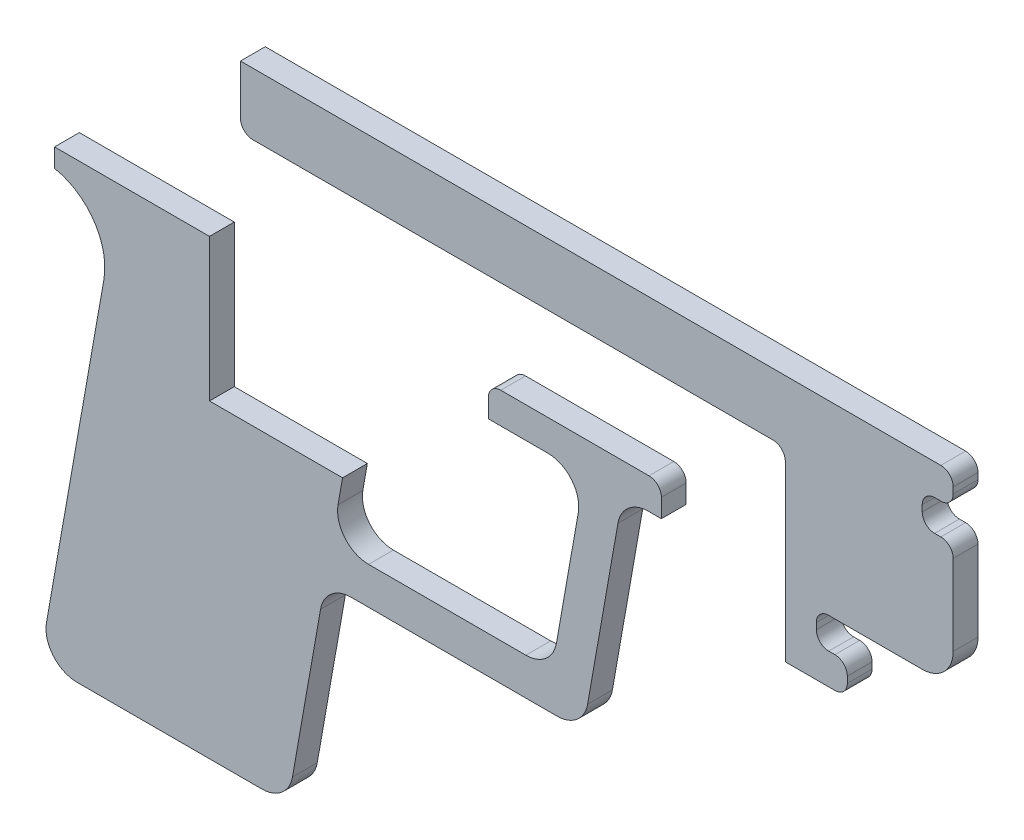
from build123d import *

# Parameters (mm, degrees)
BOSS_EXTRUDE1_DEPTH = 4
FILLET1_R           = 10
FILLET2_R           = 5
CUT_EXTRUDE1_DEPTH  = 4
LPATTERN1_COUNT     = 6
LPATTERN1_PITCH     = 4
FILLET3_R           = 2
FILLET4_R           = 2
BOSS_EXTRUDE2_DEPTH = 4
FILLET5_R           = 2
CUT_EXTRUDE2_DEPTH  = 4
FILLET6_R           = 2
FILLET7_R           = 2
FILLET8_R           = 2
FILLET9_R           = 2


with BuildPart() as part:
    # Sketch1 → Boss-Extrude1 (new body)
    with BuildSketch(Plane.XY):
        Polygon((10, 0), (-2.34288865, -70), (37.65711135, -70), (43.652228694, -36), (85.284719782, -36), (91.632491087, 0), (145, 0), (145, 20), (140, 20), (140, 25), (145, 25), (145, 30), (0, 30), (0, 0), align=None)
        Polygon((44.710190579, -30), (80.250121995, -30), (85.539931416, 0), (50, 0), align=None, mode=Mode.SUBTRACT)
    extrude(amount=BOSS_EXTRUDE1_DEPTH)

    # Fillet1
    # the kernel refuses this fillet: 10 mm, written as the material it adds along each edge
    with BuildSketch(Plane(origin=(10, 0, 0), x_dir=(-0.17364817766693433, -0.9848077530122074, 0), z_dir=(0, 0, 1))) as fillet1_piece_1:
        with BuildLine():
            CenterArc((11.735327688, -10), FILLET1_R, 90, 89.129514879)
            Line((1.736481777, -9.84807753), (1.536504858, -9.845039081))
            ThreePointArc((1.536504858, -9.845039081), (0.671279338, -4.958768401), (-0.196961551, -0.034729636))
            Line((-0.196961551, -0.034729636), (0, 0.2))
            Line((0, 0.2), (11.735327688, 0.2))
            Line((11.735327688, 0.2), (11.735327688, 0))
        make_face()
    extrude(amount=4)

    # Fillet2
    fillet2_edges = [part.edges().sort_by_distance(p)[0] for p in [
        (145, 0, 2),
        (91.632491087, 0, 2),
        (85.284719782, -36, 2),
        (43.652228694, -36, 2),
        (37.65711135, -70, 2),
        (-2.34288865, -70, 2),
        (85.539931416, 0, 2),
        (50, 0, 2),
        (44.710190579, -30, 2),
        (80.250121995, -30, 2),
    ]]
    fillet(fillet2_edges, radius=FILLET2_R)

    # Sketch2 → Cut-Extrude1 (cut)
    with BuildSketch(Plane.XY.offset(4)):
        Polygon((0, 27), (4, 27), (0, 23), align=None)
    cut_extrude1 = extrude(amount=-CUT_EXTRUDE1_DEPTH, mode=Mode.SUBTRACT)

    # LPattern1: Cut-Extrude1 ×6
    with Locations(*[(0, -i * LPATTERN1_PITCH, 0) for i in range(1, LPATTERN1_COUNT)]):
        add(cut_extrude1, mode=Mode.SUBTRACT)

    # Fillet3
    fillet3_edges = [part.edges().sort_by_distance(p)[0] for p in [
        (145, 25, 2),
        (140, 25, 2),
        (140, 20, 2),
        (145, 20, 2),
    ]]
    fillet(fillet3_edges, radius=FILLET3_R)

    # Fillet4
    fillet4_edges = [part.edges().sort_by_distance(p)[0] for p in [
        (145, 30, 2),
    ]]
    fillet(fillet4_edges, radius=FILLET4_R)

    # Sketch3 → Boss-Extrude2 (add)
    with BuildSketch(Plane.XY.offset(4)):
        Polygon((117.913994622, 0), (117.913994622, -10), (127.913994622, -10), (127.913994622, -5), (122.913994622, -5), (122.913994622, 0), align=None)
    extrude(amount=-BOSS_EXTRUDE2_DEPTH)

    # Fillet5
    fillet5_edges = [part.edges().sort_by_distance(p)[0] for p in [
        (122.913994622, 0, 2),
        (122.913994622, -5, 2),
        (127.913994622, -5, 2),
        (127.913994622, -10, 2),
    ]]
    fillet(fillet5_edges, radius=FILLET5_R)

    # Sketch4 → Cut-Extrude2 (cut)
    with BuildSketch(Plane.XY.offset(4)):
        Polygon((117.913994622, 0), (117.913994622, 20), (30, 20), (30, 30), (0, 30), (0, 3), (25, 3), (25, -20), (70, -20), (70, 5), (97.913994622, 5), (97.913994622, 0), align=None)
    extrude(amount=-CUT_EXTRUDE2_DEPTH, mode=Mode.SUBTRACT)


with BuildPart() as cut_extrude2_piece_1:
    # of the separate pieces the step leaves, piece 1, a body of its own (cut_extrude2_pieces)
    add(part.part.solids().sort_by_distance((97.913994622, 5, 0))[0])

    # Fillet7
    fillet7_edges = [cut_extrude2_piece_1.edges().sort_by_distance(p)[0] for p in [
        (97.913994622, 5, 2),
    ]]
    fillet(fillet7_edges, radius=FILLET7_R)

    # Fillet9
    fillet9_edges = [cut_extrude2_piece_1.edges().sort_by_distance(p)[0] for p in [
        (70, 5, 2),
    ]]
    fillet(fillet9_edges, radius=FILLET9_R)


with BuildPart() as cut_extrude2_piece_2:
    # of the separate pieces the step leaves, piece 2, a body of its own (cut_extrude2_pieces)
    add(part.part.solids().sort_by_distance((124.913994622, 0, 0))[0])

    # Fillet6
    fillet6_edges = [cut_extrude2_piece_2.edges().sort_by_distance(p)[0] for p in [
        (117.913994622, 20, 2),
    ]]
    fillet(fillet6_edges, radius=FILLET6_R)

    # Fillet8
    fillet8_edges = [cut_extrude2_piece_2.edges().sort_by_distance(p)[0] for p in [
        (30, 20, 2),
    ]]
    fillet(fillet8_edges, radius=FILLET8_R)


solid = Compound([cut_extrude2_piece_1.part, cut_extrude2_piece_2.part])
